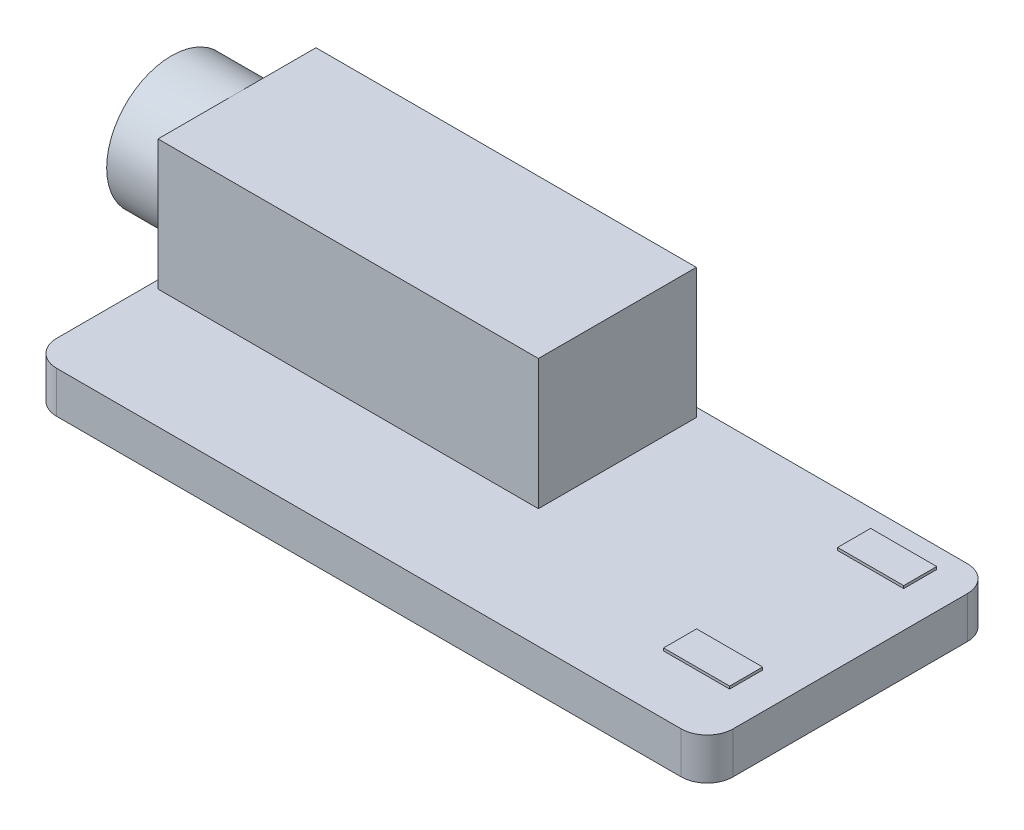
from build123d import *

# Parameters (mm, degrees)
BOSS_EXTRUDE1_DEPTH = 1.6
SKETCH2_W           = 2.54
SKETCH2_H           = 1.27
BOSS_EXTRUDE2_DEPTH = 0.1
SKETCH3_W           = 14.62
SKETCH3_H           = 6.07
BOSS_EXTRUDE3_DEPTH = 5
SKETCH4_R           = 2.49
SKETCH4_R_2         = 1.795
BOSS_EXTRUDE5_DEPTH = 2.52


with BuildPart() as part:
    # Sketch1 → Boss-Extrude1 (new body)
    with BuildSketch(Plane(origin=(0, 0, 0), x_dir=(1, 0, 0), z_dir=(0, 1, 0))):
        with BuildLine():
            Line((12, 5.5), (-12, 5.5))
            ThreePointArc((-12, 5.5), (-12.707106781, 5.207106781), (-13, 4.5))
            Line((-13, 4.5), (-13, -4.5))
            ThreePointArc((-13, -4.5), (-12.707106781, -5.207106781), (-12, -5.5))
            Line((-12, -5.5), (12, -5.5))
            ThreePointArc((12, -5.5), (12.707106781, -5.207106781), (13, -4.5))
            Line((13, -4.5), (13, 4.5))
            ThreePointArc((13, 4.5), (12.707106781, 5.207106781), (12, 5.5))
        make_face()
    extrude(amount=BOSS_EXTRUDE1_DEPTH)

    # Sketch2 → Boss-Extrude2 (add)
    with BuildSketch(Plane(origin=(0, 1.6, 0), x_dir=(1, 0, 0), z_dir=(0, 1, 0))):
        with Locations((10.34, 4.08)):
            Rectangle(SKETCH2_W, SKETCH2_H)
        with Locations((10.34, -2.61)):
            Rectangle(SKETCH2_W, SKETCH2_H)
    extrude(amount=BOSS_EXTRUDE2_DEPTH)

    # Sketch3 → Boss-Extrude3 (add)
    with BuildSketch(Plane(origin=(0, 1.6, 0), x_dir=(1, 0, 0), z_dir=(0, 1, 0))):
        with Locations((-5.38, 2.12)):
            Rectangle(SKETCH3_W, SKETCH3_H)
    extrude(amount=BOSS_EXTRUDE3_DEPTH)

    # Sketch4 → Boss-Extrude5 (add)
    with BuildSketch(Plane.ZY.offset(12.69)):
        with Locations((-2.12, 4.1)):
            Circle(SKETCH4_R)
        with Locations((-2.12, 4.1)):
            Circle(SKETCH4_R_2, mode=Mode.SUBTRACT)
    extrude(amount=BOSS_EXTRUDE5_DEPTH)


solid = part.part
